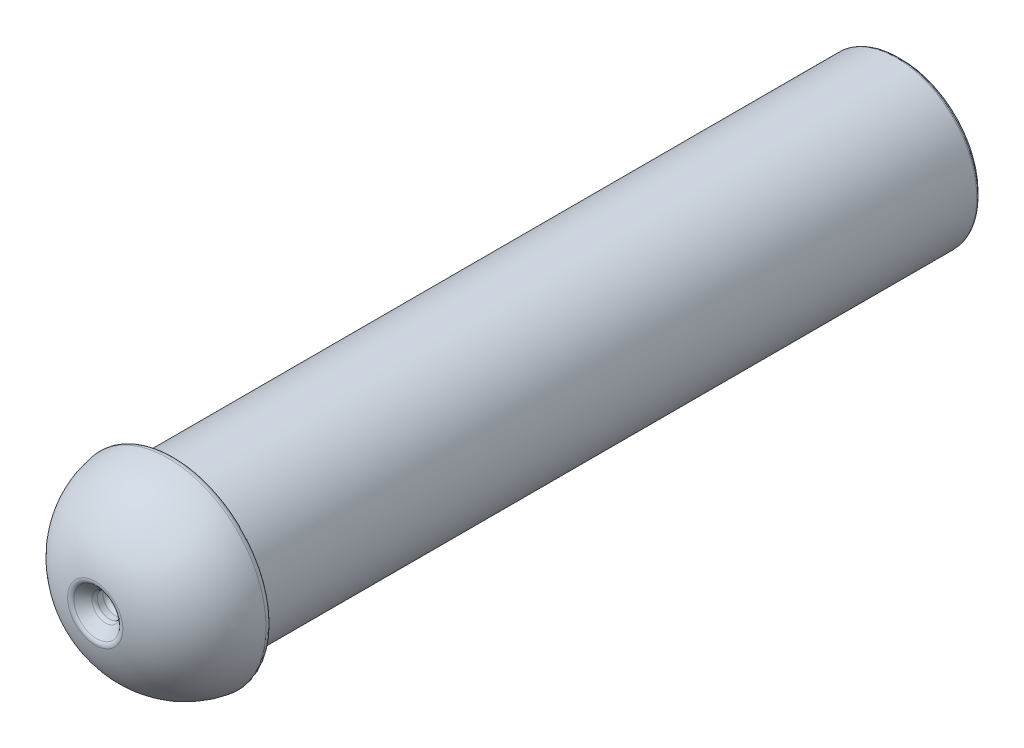
from build123d import *

# Parameters (mm, degrees)
SKETCH1_R           = 3
BOSS_EXTRUDE1_DEPTH = 27.05
SKETCH2_R           = 3.648644993
BOSS_EXTRUDE2_DEPTH = 3
FILLET1_R           = 3.2
FILLET2_R           = 0.2
SKETCH3_R           = 0.454901109
CUT_EXTRUDE1_DEPTH  = 1
FILLET3_R           = 0.2
CHAMFER1_SIZE       = 0.5
FILLET4_R           = 0.2
SKETCH4_R           = 2.384579771
CUT_EXTRUDE2_DEPTH  = 25
FILLET5_R           = 1
CHAMFER2_SIZE       = 0.2
FILLET6_R           = 0.1


with BuildPart() as part:
    # Sketch1 → Boss-Extrude1 (new body)
    with BuildSketch(Plane.XY):
        Circle(SKETCH1_R)
    extrude(amount=BOSS_EXTRUDE1_DEPTH)

    # Sketch2 → Boss-Extrude2 (add)
    with BuildSketch(Plane.XY.offset(27.05)):
        Circle(SKETCH2_R)
    extrude(amount=BOSS_EXTRUDE2_DEPTH)

    # Fillet1
    # the kernel refuses this fillet: 3.2 mm, written as the material it takes off along each edge
    with BuildSketch(Plane(origin=(0, 0, 30.05), x_dir=(1, 0, 0), z_dir=(0, -1, 0))) as fillet1_piece_1:
        with BuildLine():
            CenterArc((0.454901109, -3.2), FILLET1_R, 3.583321698, 86.416678302)
            Line((0.454901109, 0), (0.454901109, 0.064))
            Line((0.454901109, 0.064), (3.648644993, 0.064))
            Line((3.648644993, 0.064), (3.712644993, 0))
            ThreePointArc((3.712644993, 0), (3.712644993, -1.5), (3.712519871, -2.996))
            Line((3.712519871, -2.996), (3.648644993, -3))
        make_face()
    revolve(axis=Axis((0, 0, 30.05), (0, 0, 1)), mode=Mode.SUBTRACT)

    # Fillet2
    fillet2_edges = [part.edges().sort_by_distance(p)[0] for p in [
        (-3.648644993, 0, 27.05),
    ]]
    fillet(fillet2_edges, radius=FILLET2_R)

    # Sketch3 → Cut-Extrude1 (cut)
    with BuildSketch(Plane.XY.offset(30.05)):
        Circle(SKETCH3_R)
    extrude(amount=-CUT_EXTRUDE1_DEPTH, mode=Mode.SUBTRACT)

    # Fillet3
    fillet3_edges = [part.edges().sort_by_distance(p)[0] for p in [
        (-0.454901109, 0, 29.05),
    ]]
    fillet(fillet3_edges, radius=FILLET3_R)

    # Chamfer1
    # the kernel refuses this chamfer: 0.5 mm, written as the material it takes off along each edge
    with BuildSketch(Plane(origin=(0, 0, 30.05), x_dir=(1, 0, 0), z_dir=(0, -1, 0))) as chamfer1_piece_1:
        with BuildLine():
            Line((0.454901109, -CHAMFER1_SIZE), (0.920803088, -0.03409802))
            ThreePointArc((0.920803088, -0.03409802), (0.69499526, -0.009019775), (0.454901109, 0))
            Line((0.454901109, 0), (0.454901109, -CHAMFER1_SIZE))
        make_face()
    revolve(axis=Axis((0, 0, 30.05), (0, 0, 1)), mode=Mode.SUBTRACT)

    # Fillet4
    fillet4_edges = [part.edges().sort_by_distance(p)[0] for p in [
        (-0.454901109, 0, 29.55),
        (-0.920803088, 0, 30.01590198),
    ]]
    fillet(fillet4_edges, radius=FILLET4_R)

    # Sketch4 → Cut-Extrude2 (cut)
    with BuildSketch(Plane(origin=(0, 0, 0), x_dir=(-1, 0, 0), z_dir=(0, 0, -1))):
        Circle(SKETCH4_R)
    extrude(amount=-CUT_EXTRUDE2_DEPTH, mode=Mode.SUBTRACT)

    # Fillet5
    fillet5_edges = [part.edges().sort_by_distance(p)[0] for p in [
        (2.384579771, 0, 25),
    ]]
    fillet(fillet5_edges, radius=FILLET5_R)

    # Chamfer2
    chamfer2_edges = [part.edges().sort_by_distance(p)[0] for p in [
        (2.384579771, 0, 0),
        (-3, 0, 0),
    ]]
    chamfer(chamfer2_edges, length=CHAMFER2_SIZE)

    # Fillet6
    fillet6_edges = [part.edges().sort_by_distance(p)[0] for p in [
        (-3, 0, 0.2),
        (2.584579771, 0, 0),
        (-2.8, 0, 0),
        (2.384579771, 0, 0.2),
    ]]
    fillet(fillet6_edges, radius=FILLET6_R)


solid = part.part
